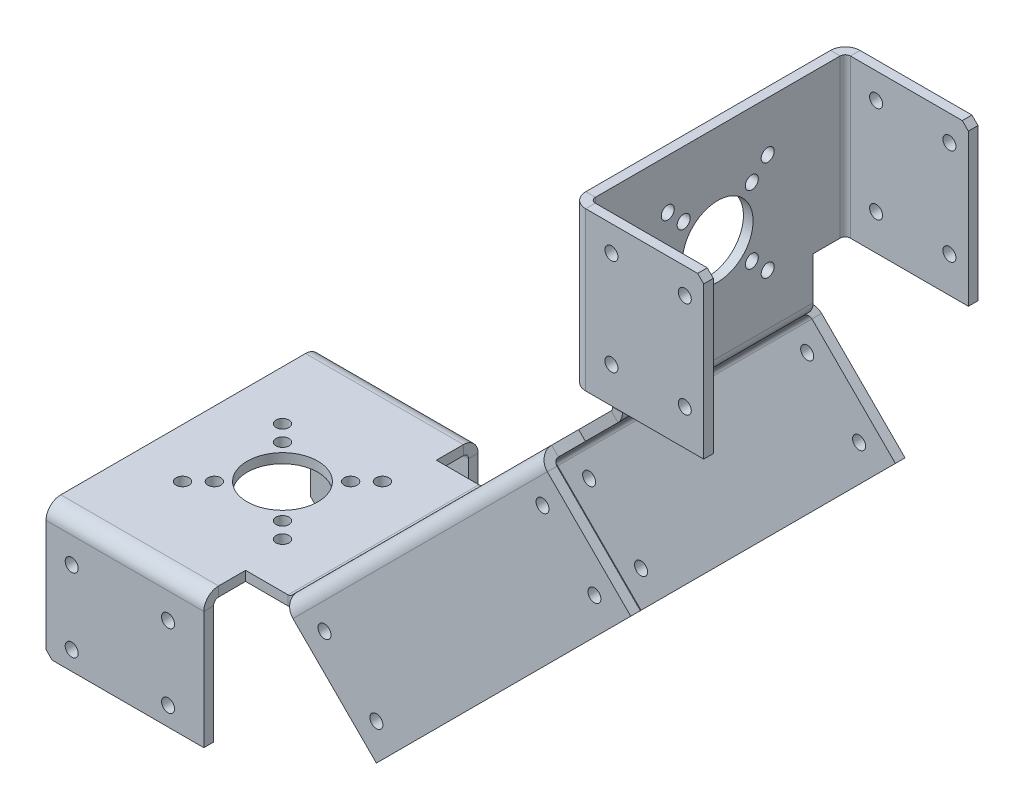
from build123d import *

# Parameters (mm, degrees)
BOSS_EXTRUDE4_DEPTH          = 29.7
SKETCH13_W                   = 50
SKETCH13_H                   = 56
BOSS_EXTRUDE5_DEPTH          = 3
MIRROR3_COPY_1_SKETCH_W      = 50
MIRROR3_COPY_1_SKETCH_H      = 56
MIRROR3_COPY_1_DEPTH         = 3
SKETCHED_START               = -79.7
SKETCHED_BEND1_DEPTH         = 159.4
SKETCHED_START_2             = -77.807381701
SKETCHED_BEND1_2_OUTLINE_W   = 49.138181769
SKETCHED_BEND1_2_OUTLINE_H   = 3
SKETCHED_BEND1_2_OUTLINE_W_2 = 3
SKETCHED_BEND1_2_OUTLINE_H_2 = 49.138181769
SKETCHED_BEND1_2_DEPTH       = 155.614763402
SKETCHED_START_3             = -29.7
SKETCHED_BEND1_3_DEPTH       = 59.4
SKETCHED_START_4             = -135.506872194
SKETCHED_BEND1_4_DEPTH       = 3
SKETCHED_START_5             = 132.506872194
SKETCHED_BEND1_5_DEPTH       = 3
SKETCHED_BEND2_DEPTH         = 3
SKETCHED_START_6             = -171.944871123
SKETCHED_BEND2_2_OUTLINE_W   = 49.138181769
SKETCHED_BEND2_2_OUTLINE_H   = 3
SKETCHED_BEND2_2_DEPTH       = 34.837798929
SKETCHED_START_7             = -30.931230202
SKETCHED_BEND2_3_DEPTH       = 49.138181769
SKETCHED_START_8             = -42.7
SKETCHED_BEND2_4_DEPTH       = 3
SKETCHED_START_9             = 39.7
SKETCHED_BEND2_5_DEPTH       = 3
SKETCHED_START_10            = -32
SKETCHED_BEND2_6_DEPTH       = 50.206951567
SKETCHED_BEND3_OUTLINE_W     = 3
SKETCHED_BEND3_OUTLINE_H     = 49.138181769
SKETCHED_BEND3_DEPTH         = 37
SKETCHED_START_11            = 42.7
SKETCHED_BEND3_2_OUTLINE_W   = 3
SKETCHED_BEND3_2_OUTLINE_H   = 49.138181769
SKETCHED_BEND3_2_DEPTH       = 37
SKETCHED_START_12            = -42.252584548
SKETCHED_BEND3_3_DEPTH       = 2.552584548
SKETCHED_BEND3_4_DEPTH       = 2.527375452
SKETCHED_START_13            = -18.206951567
SKETCHED_BEND3_5_DEPTH       = 49.138181769
SKETCHED_BEND3_6_DEPTH       = 49.138181769
SKETCHED_START_14            = 143.455066987
SKETCHED_BEND3_7_OUTLINE_W   = 6
SKETCHED_BEND3_7_OUTLINE_H   = 1.772624548
SKETCHED_BEND3_7_OUTLINE_H_2 = 1.747415452
SKETCHED_BEND3_7_DEPTH       = 2.544933013
SKETCHED_START_15            = -56
SKETCHED_BEND4_DEPTH         = 112
SKETCHED_BEND4_2_DEPTH       = 112
CUT_EXTRUDE5_DEPTH           = 250.524017796
CUT_EXTRUDE5_DEPTH_BACK      = 250.524017796
SKETCH26_R                   = 2.025
SKETCH12_R                   = 11
SKETCH12_R_2                 = 2.025
CUT_EXTRUDE6_DEPTH           = 272.942673446


with BuildPart() as part:
    # Sketch6 → Boss-Extrude4 (new, symmetric)
    with BuildSketch(Plane.XY):
        Polygon((82.30229073, -82.30229073), (32, -132.60458146), (-13.254833996, -177.859415456), (-11.133513652, -179.980735799), (84.423611074, -84.423611074), align=None)
    boss_extrude4 = extrude(amount=BOSS_EXTRUDE4_DEPTH, both=True)

    # Sketch13 → Boss-Extrude5 (add)
    with BuildSketch(Plane(origin=(82.30229073, -82.30229073, 0), x_dir=(0, 0, 1), z_dir=(-0.7071067811865478, 0.7071067811865472, 0))):
        Polygon((29.7, -135.138181769), (77.807381701, -135.138181769), (79.7, -133.24556347), (79.7, -86), (29.7, -86), align=None)
        with Locations((54.7, -28)):
            Rectangle(SKETCH13_W, SKETCH13_H)
    boss_extrude5 = extrude(amount=-BOSS_EXTRUDE5_DEPTH)

    # Mirror2: Boss-Extrude5 across plane
    add(boss_extrude5.mirror(Plane.XY))

    # Mirror3: Boss-Extrude4, Boss-Extrude5 across plane
    add(boss_extrude4.mirror(Plane(origin=(0, 0, 0), x_dir=(0, 0, 1), z_dir=(0.7071067811865476, 0.7071067811865476, 0))))
    add(boss_extrude5.mirror(Plane(origin=(0, 0, 0), x_dir=(0, 0, 1), z_dir=(0.7071067811865476, 0.7071067811865476, 0))))

    # Mirror3 copy 1 sketch → Mirror3 copy 1 (add)
    with BuildSketch(Plane(origin=(82.30229073, -82.30229073, 0), x_dir=(0, 0, -1), z_dir=(-0.7071067811865472, 0.7071067811865478, 0))):
        Polygon((29.7, -135.138181769), (77.807381701, -135.138181769), (79.7, -133.24556347), (79.7, -86), (29.7, -86), align=None)
        with Locations((54.7, -28)):
            Rectangle(MIRROR3_COPY_1_SKETCH_W, MIRROR3_COPY_1_SKETCH_H)
    extrude(amount=-MIRROR3_COPY_1_DEPTH)

    # Sketched Bend1: read off the stored shape, not the designer's step
    # Sketched Bend1 outline → Sketched Bend1 (cut)
    with BuildSketch(Plane.XY.offset(SKETCHED_START)):
        with BuildLine():
            Line((31.434884723, -135.506872194), (29.097709266, -135.506872194))
            Line((29.097709266, -135.506872194), (-13.254833996, -177.859415456))
            Line((-13.254833996, -177.859415456), (-11.133513652, -179.980735799))
            Line((-11.133513652, -179.980735799), (34.687717338, -134.159504809))
            ThreePointArc((34.687717338, -134.159504809), (33.195305049, -135.15670282), (31.434884723, -135.506872194))
        make_face()
        with BuildLine():
            Line((135.506872194, -29.097709266), (135.506872194, -31.434884723))
            ThreePointArc((135.506872194, -31.434884723), (135.15670282, -33.195305049), (134.159504809, -34.687717338))
            Line((134.159504809, -34.687717338), (179.980735799, 11.133513652))
            Line((179.980735799, 11.133513652), (177.859415456, 13.254833996))
            Line((177.859415456, 13.254833996), (135.506872194, -29.097709266))
        make_face()
    extrude(amount=SKETCHED_BEND1_DEPTH, mode=Mode.SUBTRACT)



with BuildPart() as body_2:
    # Sketched Bend1 2 outline → Sketched Bend1 2 (new body)
    with BuildSketch(Plane.XY.offset(SKETCHED_START_2)):
        with Locations((-6.362139318, -134.006872194)):
            Rectangle(SKETCHED_BEND1_2_OUTLINE_W, SKETCHED_BEND1_2_OUTLINE_H)
        with Locations((134.006872194, 6.362139318)):
            Rectangle(SKETCHED_BEND1_2_OUTLINE_W_2, SKETCHED_BEND1_2_OUTLINE_H_2)
    extrude(amount=SKETCHED_BEND1_2_DEPTH)


with BuildPart() as part_1:
    add(part.part)

    add(body_2.part)  # Sketched Bend1 3 merges body 2
    # Sketched Bend1 3 outline → Sketched Bend1 3 (add)
    with BuildSketch(Plane.XY.offset(SKETCHED_START_3)):
        with BuildLine():
            ThreePointArc((32.566396995, -132.038184465), (32.047254752, -132.385064222), (31.434884723, -132.506872194))
            Line((31.434884723, -132.506872194), (18.206951567, -132.506872194))
            Line((18.206951567, -132.506872194), (18.206951567, -135.506872194))
            Line((18.206951567, -135.506872194), (29.097709266, -135.506872194))
            Line((29.097709266, -135.506872194), (32.566396995, -132.038184465))
        make_face()
        with BuildLine():
            ThreePointArc((132.506872194, -31.434884723), (132.385064222, -32.047254752), (132.038184465, -32.566396995))
            Line((132.038184465, -32.566396995), (135.506872194, -29.097709266))
            Line((135.506872194, -29.097709266), (135.506872194, -18.206951567))
            Line((135.506872194, -18.206951567), (132.506872194, -18.206951567))
            Line((132.506872194, -18.206951567), (132.506872194, -31.434884723))
        make_face()
    extrude(amount=SKETCHED_BEND1_3_DEPTH)

    # Sketched Bend1 4 outline → Sketched Bend1 4 (add)
    with BuildSketch(Plane(origin=(0, 0, 0), x_dir=(1, 0, 0), z_dir=(0, 1, 0)).offset(SKETCHED_START_4)):
        Polygon((18.206951567, 79.7), (-29.038611903, 79.7), (-30.931230202, 77.807381701), (18.206951567, 77.807381701), align=None)
        Polygon((-30.931230202, -77.807381701), (-29.038611903, -79.7), (18.206951567, -79.7), (18.206951567, -77.807381701), align=None)
    extrude(amount=SKETCHED_BEND1_4_DEPTH)

    # Sketched Bend1 5 outline → Sketched Bend1 5 (add)
    with BuildSketch(Plane.YZ.offset(SKETCHED_START_5)):
        Polygon((-18.206951567, -77.807381701), (-18.206951567, -79.7), (29.038611903, -79.7), (30.931230202, -77.807381701), align=None)
        Polygon((29.038611903, 79.7), (-18.206951567, 79.7), (-18.206951567, 77.807381701), (30.931230202, 77.807381701), align=None)
    extrude(amount=SKETCHED_BEND1_5_DEPTH)

    # Sketched Bend2: read off the stored shape, not the designer's step
    # Sketched Bend2 outline → Sketched Bend2 (cut)
    with BuildSketch(Plane(origin=(0, 0, 0), x_dir=(1, 0, 0), z_dir=(0, 1, 0)).offset(SKETCHED_START_4)):
        Polygon((18.206951567, -42.7), (-30.931230202, -42.7), (-30.931230202, -77.807381701), (-29.038611903, -79.7), (18.206951567, -79.7), align=None)
        Polygon((-30.931230202, 77.807381701), (-30.931230202, 42.7), (18.206951567, 42.7), (18.206951567, 79.7), (-29.038611903, 79.7), align=None)
    extrude(amount=SKETCHED_BEND2_DEPTH, mode=Mode.SUBTRACT)



with BuildPart() as body_2_2:
    # Sketched Bend2 2 outline → Sketched Bend2 2 (new body)
    with BuildSketch(Plane(origin=(0, 0, 0), x_dir=(1, 0, 0), z_dir=(0, 1, 0)).offset(SKETCHED_START_6)):
        with Locations((-6.362139318, -41.2)):
            Rectangle(SKETCHED_BEND2_2_OUTLINE_W, SKETCHED_BEND2_2_OUTLINE_H)
        with Locations((-6.362139318, 41.2)):
            Rectangle(SKETCHED_BEND2_2_OUTLINE_W, SKETCHED_BEND2_2_OUTLINE_H)
    extrude(amount=SKETCHED_BEND2_2_DEPTH)


with BuildPart() as part_2:
    add(part_1.part)

    add(body_2_2.part)  # Sketched Bend2 3 merges body 2 2
    # Sketched Bend2 3 outline → Sketched Bend2 3 (add)
    with BuildSketch(Plane.YZ.offset(SKETCHED_START_7)):
        with BuildLine():
            Line((-135.506872194, 38.0998), (-135.506872194, 42.41271085))
            ThreePointArc((-135.506872194, 42.41271085), (-136.294179966, 42.627608108), (-137.107072194, 42.7))
            Line((-137.107072194, 42.7), (-137.107072194, 39.7))
            ThreePointArc((-137.107072194, 39.7), (-135.975559923, 39.231312271), (-135.506872194, 38.0998))
        make_face()
        with BuildLine():
            ThreePointArc((-137.107072194, -42.7), (-136.294179966, -42.627608108), (-135.506872194, -42.41271085))
            Line((-135.506872194, -42.41271085), (-135.506872194, -38.0998))
            ThreePointArc((-135.506872194, -38.0998), (-135.975559923, -39.231312271), (-137.107072194, -39.7))
            Line((-137.107072194, -39.7), (-137.107072194, -42.7))
        make_face()
    extrude(amount=SKETCHED_BEND2_3_DEPTH)

    # Sketched Bend2 4 outline → Sketched Bend2 4 (add)
    with BuildSketch(Plane.XY.offset(SKETCHED_START_8)):
        Polygon((-30.931230202, -171.944871123), (-29.038611903, -173.837489422), (18.206951567, -173.837489422), (18.206951567, -171.944871123), align=None)
    extrude(amount=SKETCHED_BEND2_4_DEPTH)

    # Sketched Bend2 5 outline → Sketched Bend2 5 (add)
    with BuildSketch(Plane.XY.offset(SKETCHED_START_9)):
        Polygon((-30.931230202, -171.944871123), (-29.038611903, -173.837489422), (18.206951567, -173.837489422), (18.206951567, -171.944871123), align=None)
    extrude(amount=SKETCHED_BEND2_5_DEPTH)

    # Sketched Bend2 6 outline → Sketched Bend2 6 (cut)
    with BuildSketch(Plane.YZ.offset(SKETCHED_START_10)):
        with BuildLine():
            ThreePointArc((-135.506872194, 42.41271085), (-133.33062677, 40.726642211), (-132.506872194, 38.0998))
            Line((-132.506872194, 38.0998), (-132.506872194, 42.7))
            Line((-132.506872194, 42.7), (-135.506872194, 42.7))
            Line((-135.506872194, 42.7), (-135.506872194, 42.41271085))
        make_face()
        with BuildLine():
            Line((-132.506872194, -42.7), (-132.506872194, -38.0998))
            ThreePointArc((-132.506872194, -38.0998), (-133.33062677, -40.726642211), (-135.506872194, -42.41271085))
            Line((-135.506872194, -42.41271085), (-135.506872194, -42.7))
            Line((-135.506872194, -42.7), (-132.506872194, -42.7))
        make_face()
    extrude(amount=SKETCHED_BEND2_6_DEPTH, mode=Mode.SUBTRACT)

    # Sketched Bend3: read off the stored shape, not the designer's step
    # Sketched Bend3 outline → Sketched Bend3 (cut)
    with BuildSketch(Plane.XY.offset(SKETCHED_START)):
        with Locations((134.006872194, 6.362139318)):
            Rectangle(SKETCHED_BEND3_OUTLINE_W, SKETCHED_BEND3_OUTLINE_H)
    extrude(amount=SKETCHED_BEND3_DEPTH, mode=Mode.SUBTRACT)

    # Sketched Bend3 2 outline → Sketched Bend3 2 (cut)
    with BuildSketch(Plane.XY.offset(SKETCHED_START_11)):
        with Locations((134.006872194, 6.362139318)):
            Rectangle(SKETCHED_BEND3_2_OUTLINE_W, SKETCHED_BEND3_2_OUTLINE_H)
    extrude(amount=SKETCHED_BEND3_2_DEPTH, mode=Mode.SUBTRACT)

    # Sketched Bend3 3 outline → Sketched Bend3 3 (add)
    with BuildSketch(Plane.XY.offset(SKETCHED_START_12)):
        Polygon((171.944871123, 30.931230202), (135.506872194, 30.931230202), (135.506872194, -18.206951567), (173.837489422, -18.206951567), (173.837489422, 29.038611903), align=None)
    extrude(amount=SKETCHED_BEND3_3_DEPTH)

    # Sketched Bend3 4 outline → Sketched Bend3 4 (add)
    with BuildSketch(Plane.XY.offset(SKETCHED_START_9)):
        Polygon((171.944871123, 30.931230202), (135.506872194, 30.931230202), (135.506872194, -18.206951567), (173.837489422, -18.206951567), (173.837489422, 29.038611903), align=None)
    extrude(amount=SKETCHED_BEND3_4_DEPTH)

    # Sketched Bend3 5 outline → Sketched Bend3 5 (cut)
    with BuildSketch(Plane(origin=(0, 0, 0), x_dir=(1, 0, 0), z_dir=(0, 1, 0)).offset(SKETCHED_START_13)):
        with BuildLine():
            Line((135.506872194, -42.7), (135.506872194, -42.41271085))
            ThreePointArc((135.506872194, -42.41271085), (133.33062677, -40.726642211), (132.506872194, -38.0998))
            Line((132.506872194, -38.0998), (132.506872194, -42.7))
            Line((132.506872194, -42.7), (135.506872194, -42.7))
        make_face()
        with BuildLine():
            Line((132.506872194, 42.7), (132.506872194, 38.0998))
            ThreePointArc((132.506872194, 38.0998), (133.33062677, 40.726642211), (135.506872194, 42.41271085))
            Line((135.506872194, 42.41271085), (135.506872194, 42.7))
            Line((135.506872194, 42.7), (132.506872194, 42.7))
        make_face()
    extrude(amount=SKETCHED_BEND3_5_DEPTH, mode=Mode.SUBTRACT)

    # Sketched Bend3 6 outline → Sketched Bend3 6 (add)
    with BuildSketch(Plane(origin=(0, 0, 0), x_dir=(1, 0, 0), z_dir=(0, 1, 0)).offset(SKETCHED_START_13)):
        with BuildLine():
            ThreePointArc((135.506872194, -42.41271085), (136.294179966, -42.627608108), (137.107072194, -42.7))
            Line((137.107072194, -42.7), (173.837489422, -42.7))
            Line((173.837489422, -42.7), (173.837489422, -42.227375452))
            Line((173.837489422, -42.227375452), (135.506872194, -42.227375452))
            Line((135.506872194, -42.227375452), (135.506872194, -42.41271085))
        make_face()
        with BuildLine():
            Line((135.506872194, -39.7), (137.107072194, -39.7))
            ThreePointArc((137.107072194, -39.7), (135.975559923, -39.231312271), (135.506872194, -38.0998))
            Line((135.506872194, -38.0998), (135.506872194, -39.7))
        make_face()
        with BuildLine():
            ThreePointArc((137.107072194, 42.7), (136.294179966, 42.627608108), (135.506872194, 42.41271085))
            Line((135.506872194, 42.41271085), (135.506872194, 42.252584548))
            Line((135.506872194, 42.252584548), (173.837489422, 42.252584548))
            Line((173.837489422, 42.252584548), (173.837489422, 42.7))
            Line((173.837489422, 42.7), (137.107072194, 42.7))
        make_face()
        with BuildLine():
            Line((135.506872194, 39.7), (135.506872194, 38.0998))
            ThreePointArc((135.506872194, 38.0998), (135.975559923, 39.231312271), (137.107072194, 39.7))
            Line((137.107072194, 39.7), (135.506872194, 39.7))
        make_face()
    extrude(amount=SKETCHED_BEND3_6_DEPTH)

    # Sketched Bend3 7 outline → Sketched Bend3 7 (cut)
    with BuildSketch(Plane(origin=(0, 0, 0), x_dir=(0.707106781186546, -0.707106781186549, 0), z_dir=(0.707106781186549, 0.707106781186546, 0)).offset(SKETCHED_START_14)):
        with Locations((101, -43.113687726)):
            Rectangle(SKETCHED_BEND3_7_OUTLINE_W, SKETCHED_BEND3_7_OUTLINE_H)
        with Locations((101, 43.126292274)):
            Rectangle(SKETCHED_BEND3_7_OUTLINE_W, SKETCHED_BEND3_7_OUTLINE_H_2)
    extrude(amount=SKETCHED_BEND3_7_DEPTH, mode=Mode.SUBTRACT)

    # Sketched Bend4: read off the stored shape, not the designer's step
    # Sketched Bend4 outline → Sketched Bend4 (cut)
    with BuildSketch(Plane(origin=(0, 0, 0), x_dir=(0.707106781186548, -0.707106781186547, 0), z_dir=(0.707106781186547, 0.707106781186548, 0)).offset(SKETCHED_START_15)):
        with BuildLine():
            Line((119.393015765, -79.7), (119.393015765, -42.41271085))
            ThreePointArc((119.393015765, -42.41271085), (117.216770341, -40.726642211), (116.393015765, -38.0998))
            Line((116.393015765, -38.0998), (116.393015765, -79.7))
            Line((116.393015765, -79.7), (119.393015765, -79.7))
        make_face()
        with BuildLine():
            Line((116.393015765, 79.7), (116.393015765, 38.0998))
            ThreePointArc((116.393015765, 38.0998), (117.216770341, 40.726642211), (119.393015765, 42.41271085))
            Line((119.393015765, 42.41271085), (119.393015765, 79.7))
            Line((119.393015765, 79.7), (116.393015765, 79.7))
        make_face()
    extrude(amount=SKETCHED_BEND4_DEPTH, mode=Mode.SUBTRACT)

    # Sketched Bend4 2 outline → Sketched Bend4 2 (add)
    with BuildSketch(Plane(origin=(0, 0, 0), x_dir=(0.707106781186548, -0.707106781186547, 0), z_dir=(0.707106781186547, 0.707106781186548, 0)).offset(SKETCHED_START_15)):
        with BuildLine():
            ThreePointArc((119.393015765, -42.41271085), (120.180323537, -42.627608108), (120.993215765, -42.7))
            Line((120.993215765, -42.7), (157.723632992, -42.7))
            Line((157.723632992, -42.7), (157.723632992, -39.7))
            Line((157.723632992, -39.7), (120.993215765, -39.7))
            ThreePointArc((120.993215765, -39.7), (119.861703494, -39.231312272), (119.393015765, -38.0998))
            Line((119.393015765, -38.0998), (119.393015765, -42.41271085))
        make_face()
        with BuildLine():
            Line((119.393015765, 42.41271085), (119.393015765, 38.0998))
            ThreePointArc((119.393015765, 38.0998), (119.861703494, 39.231312272), (120.993215765, 39.7))
            Line((120.993215765, 39.7), (157.723632992, 39.7))
            Line((157.723632992, 39.7), (157.723632992, 42.7))
            Line((157.723632992, 42.7), (120.993215765, 42.7))
            ThreePointArc((120.993215765, 42.7), (120.180323537, 42.627608108), (119.393015765, 42.41271085))
        make_face()
    extrude(amount=SKETCHED_BEND4_2_DEPTH)

    # Sketch26 → Cut-Extrude5 (cut, two sides: drawn at the far end of the back side and taken through both)
    with BuildSketch(Plane.XY.offset(-CUT_EXTRUDE5_DEPTH_BACK)):
        with Locations((-22.931230202, -145.107072194)):
            Circle(SKETCH26_R)
        with Locations((7.068769798, -145.107072194)):
            Circle(SKETCH26_R)
        with Locations((-22.931230202, -167.944306144)):
            Circle(SKETCH26_R)
        with Locations((7.068769798, -167.944306144)):
            Circle(SKETCH26_R)
        with Locations((55.781107706, -123.6633587)):
            Circle(SKETCH26_R)
        with Locations((71.929470696, -139.81172169)):
            Circle(SKETCH26_R)
        with Locations(Location((123.6633587, -55.781107706, 0), (0, 0, 180))):
            Circle(SKETCH26_R)
        with Locations(Location((139.81172169, -71.929470696, 0), (0, 0, 180))):
            Circle(SKETCH26_R)
        with Locations(Location((145.107072194, 22.931230202, 0), (0, 0, 180))):
            Circle(SKETCH26_R)
        with Locations(Location((145.107072194, -7.068769798, 0), (0, 0, 180))):
            Circle(SKETCH26_R)
        with Locations(Location((167.944306144, -7.068769798, 0), (0, 0, 180))):
            Circle(SKETCH26_R)
        with Locations(Location((167.944306144, 22.931230202, 0), (0, 0, 180))):
            Circle(SKETCH26_R)
        Polygon((-34.603854219, -276.99018161), (276.99018161, 34.603854219), (373.181607564, -61.587571735), (61.587571735, -373.181607564), align=None)
    extrude(amount=CUT_EXTRUDE5_DEPTH + CUT_EXTRUDE5_DEPTH_BACK, mode=Mode.SUBTRACT)

    # Sketch12 → Cut-Extrude6 (cut, symmetric)
    with BuildSketch(Plane(origin=(-39.276363544, -132.506872194, 0), x_dir=(0, 0, 1), z_dir=(0, -1, 0))):
        with Locations(Location((0, -39.276363544, 0), (0, 0, 90))):
            Circle(SKETCH12_R)
        with Locations(Location((-10.606601718, -49.882965261, 0), (0, 0, 90))):
            Circle(SKETCH12_R_2)
        with Locations(Location((-15.556349186, -54.83271273, 0), (0, 0, 90))):
            Circle(SKETCH12_R_2)
        with Locations(Location((-15.556349186, -23.720014358, 0), (0, 0, 90))):
            Circle(SKETCH12_R_2)
        with Locations(Location((-10.606601718, -28.669761826, 0), (0, 0, 90))):
            Circle(SKETCH12_R_2)
        with Locations(Location((15.556349186, -23.720014358, 0), (0, 0, 90))):
            Circle(SKETCH12_R_2)
        with Locations(Location((10.606601718, -28.669761826, 0), (0, 0, 90))):
            Circle(SKETCH12_R_2)
        with Locations(Location((15.556349186, -54.83271273, 0), (0, 0, 90))):
            Circle(SKETCH12_R_2)
        with Locations(Location((10.606601718, -49.882965261, 0), (0, 0, 90))):
            Circle(SKETCH12_R_2)
    cut_extrude6 = extrude(amount=CUT_EXTRUDE6_DEPTH, both=True, mode=Mode.SUBTRACT)

    # Mirror4: Cut-Extrude6 across plane
    add(cut_extrude6.mirror(Plane(origin=(0, 0, 0), x_dir=(0, 0, 1), z_dir=(0.7071067811865476, 0.7071067811865476, 0))), mode=Mode.SUBTRACT)


solid = part_2.part
